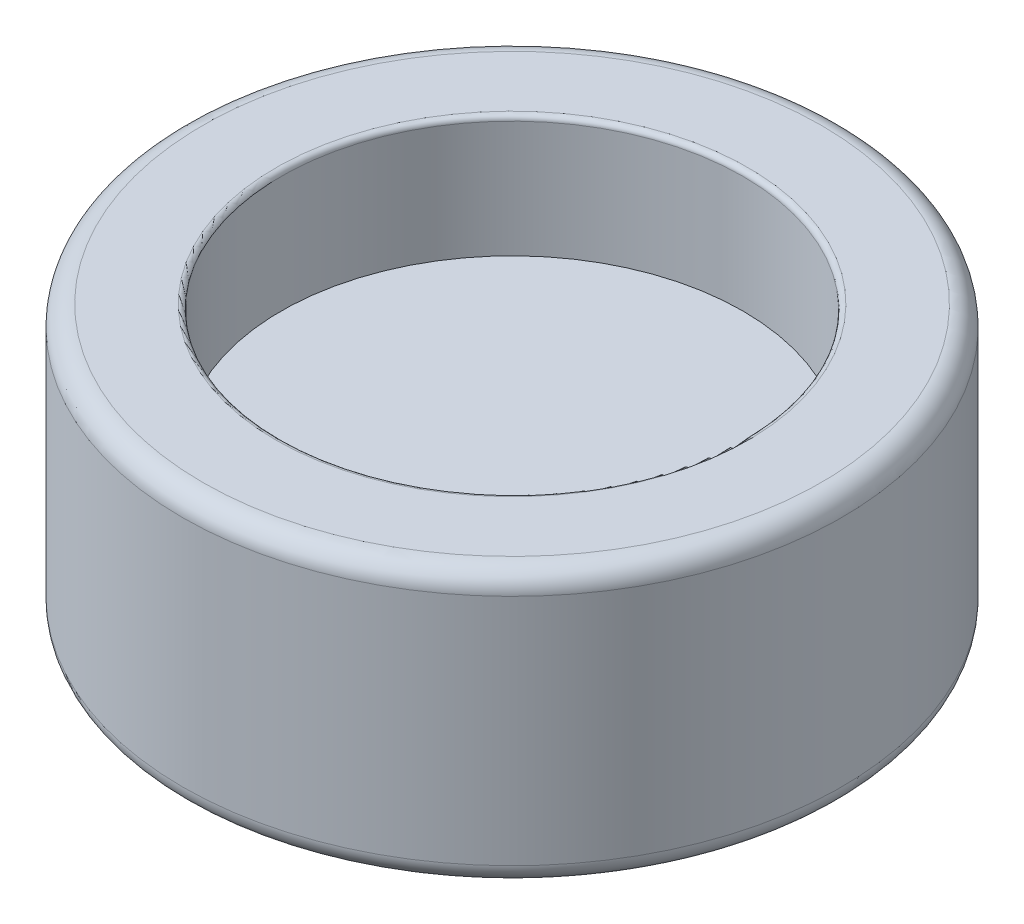
from build123d import *

# Parameters (mm, degrees)
SKETCH_1_R      = 32.5
SKETCH_1_R_2    = 22.779013497
EXTRUDE_1_DEPTH = 27
FILLET_1_R      = 2
FILLET_2_R      = 0.5
SKETCH_1_3_R    = 22.779013497
EXTRUDE_2_DEPTH = 15


with BuildPart() as part:
    # 草图1 → 凸台-拉伸1 (new body)
    with BuildSketch(Plane(origin=(0, 0, 0), x_dir=(1, 0, 0), z_dir=(0, 1, 0))):
        Circle(SKETCH_1_R)
        Circle(SKETCH_1_R_2, mode=Mode.SUBTRACT)
    extrude(amount=EXTRUDE_1_DEPTH)

    # 圆角1
    fillet_1_edges = [part.edges().sort_by_distance(p)[0] for p in [
        (-32.5, 27, 0),
        (-32.5, 0, 0),
    ]]
    fillet(fillet_1_edges, radius=FILLET_1_R)

    # 圆角2
    fillet_2_edges = [part.edges().sort_by_distance(p)[0] for p in [
        (-22.779013497, 27, 0),
        (-22.779013497, 0, 0),
    ]]
    fillet(fillet_2_edges, radius=FILLET_2_R)

    # 草图1<3> → 凸台-拉伸2 (add)
    with BuildSketch(Plane(origin=(0, 0, 0), x_dir=(1, 0, 0), z_dir=(0, 1, 0))):
        Circle(SKETCH_1_3_R)
    extrude(amount=EXTRUDE_2_DEPTH)


solid = part.part
